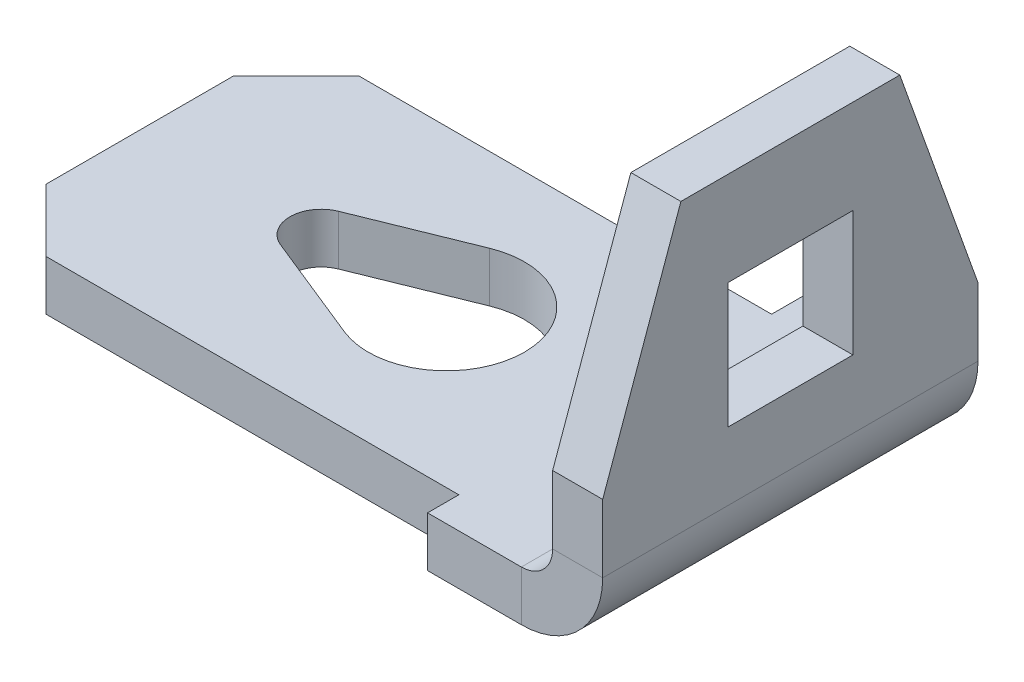
from build123d import *

# Parameters (mm, degrees)
SKETCH_1_W             = 2
SKETCH_1_H             = 2
SM_BASE_FLANGE_1_DEPTH = 0.8
OTHER_START            = -3
OTHER_2_DEPTH          = 6
OTHER_START_2          = -1.75
OTHER_2_2_OUTLINE_W    = 0.8
OTHER_2_2_OUTLINE_H    = 1.5
OTHER_2_2_DEPTH        = 3.5
OTHER_2_3_DEPTH        = 6
OTHER_2_4_OUTLINE_W    = 0.8
OTHER_2_4_OUTLINE_H    = 2
OTHER_2_4_DEPTH        = 0.75
OTHER_START_3          = 1
OTHER_2_5_OUTLINE_W    = 0.8
OTHER_2_5_OUTLINE_H    = 2
OTHER_2_5_DEPTH        = 0.75
OTHER_2_6_DEPTH        = 0.8


with BuildPart() as part:
    # Базовая кромка1: sheet metal written as solids
    # Sketch 1 → Базовая кромка1 (new body)
    with BuildSketch(Plane(origin=(0, 0, 0), x_dir=(1, 0, 0), z_dir=(0, 1, 0))):
        Polygon((2.5, -1.75), (2.5, 1.75), (-1, 3), (-5, 3), (-5, 2.5), (-11.6, 2.5), (-12.6, 1.5), (-12.6, -1.5), (-11.6, -2.5), (-5, -2.5), (-5, -3), (-1, -3), align=None)
        with BuildLine():
            Line((-9.8875, 0.463512405), (-8.16875, 1.158781014))
            ThreePointArc((-8.16875, 1.158781014), (-6.45, 0), (-8.16875, -1.158781014))
            Line((-8.16875, -1.158781014), (-9.8875, -0.463512405))
            ThreePointArc((-9.8875, -0.463512405), (-10.2, 0), (-9.8875, 0.463512405))
        make_face(mode=Mode.SUBTRACT)
        Rectangle(SKETCH_1_W, SKETCH_1_H, mode=Mode.SUBTRACT)
    extrude(amount=-SM_BASE_FLANGE_1_DEPTH)

    # Other 2: read off the stored shape, not the designer's step
    # Other 2 outline → Other 2 (cut)
    with BuildSketch(Plane.XY.offset(OTHER_START)):
        with BuildLine():
            ThreePointArc((-2.299999999, 0), (-2.778889744, -0.581665383), (-3.5, -0.8))
            Line((-3.5, -0.8), (2.5, -0.8))
            Line((2.5, -0.8), (2.5, 0))
            Line((2.5, 0), (-2.299999999, 0))
        make_face()
    extrude(amount=OTHER_2_DEPTH, mode=Mode.SUBTRACT)

    # Other 2 2 outline → Other 2 2 (add)
    with BuildSketch(Plane.XY.offset(OTHER_START_2)):
        with Locations((-2.6, 4.336283306)):
            Rectangle(OTHER_2_2_OUTLINE_W, OTHER_2_2_OUTLINE_H)
        with BuildLine():
            Line((-2.2, 0.5), (-2.2, 1.586283306))
            Line((-2.2, 1.586283306), (-3, 1.586283306))
            Line((-3, 1.586283306), (-3, 0.5))
            ThreePointArc((-3, 0.5), (-3.146446609, 0.146446609), (-3.5, 0))
            Line((-3.5, 0), (-2.299999999, 0))
            ThreePointArc((-2.299999999, 0), (-2.225245121, 0.245049024), (-2.2, 0.5))
        make_face()
    extrude(amount=OTHER_2_2_DEPTH)

    # Other 2 3 outline → Other 2 3 (add)
    with BuildSketch(Plane.XY.offset(OTHER_START)):
        with BuildLine():
            Line((-2.2, 0.5), (-2.2, 1.586283306))
            Line((-2.2, 1.586283306), (-3, 1.586283306))
            Line((-3, 1.586283306), (-3, 0.5))
            ThreePointArc((-3, 0.5), (-3.146446609, 0.146446609), (-3.5, 0))
            Line((-3.5, 0), (-2.299999999, 0))
            ThreePointArc((-2.299999999, 0), (-2.225245121, 0.245049024), (-2.2, 0.5))
        make_face()
    extrude(amount=OTHER_2_3_DEPTH)

    # Other 2 4 outline → Other 2 4 (add)
    with BuildSketch(Plane.XY.offset(OTHER_START_2)):
        with Locations((-2.6, 2.586283306)):
            Rectangle(OTHER_2_4_OUTLINE_W, OTHER_2_4_OUTLINE_H)
    extrude(amount=OTHER_2_4_DEPTH)

    # Other 2 5 outline → Other 2 5 (add)
    with BuildSketch(Plane.XY.offset(OTHER_START_3)):
        with Locations((-2.6, 2.586283306)):
            Rectangle(OTHER_2_5_OUTLINE_W, OTHER_2_5_OUTLINE_H)
    extrude(amount=OTHER_2_5_DEPTH)

    # Other 2 6 outline → Other 2 6 (add)
    with BuildSketch(Plane.YZ.offset(OTHER_START)):
        Polygon((1.586283306, -1.75), (1.586283306, -3), (5.086283306, -1.75), align=None)
        Polygon((1.586283306, 1.75), (5.086283306, 1.75), (1.586283306, 3), align=None)
    extrude(amount=OTHER_2_6_DEPTH)


solid = part.part
